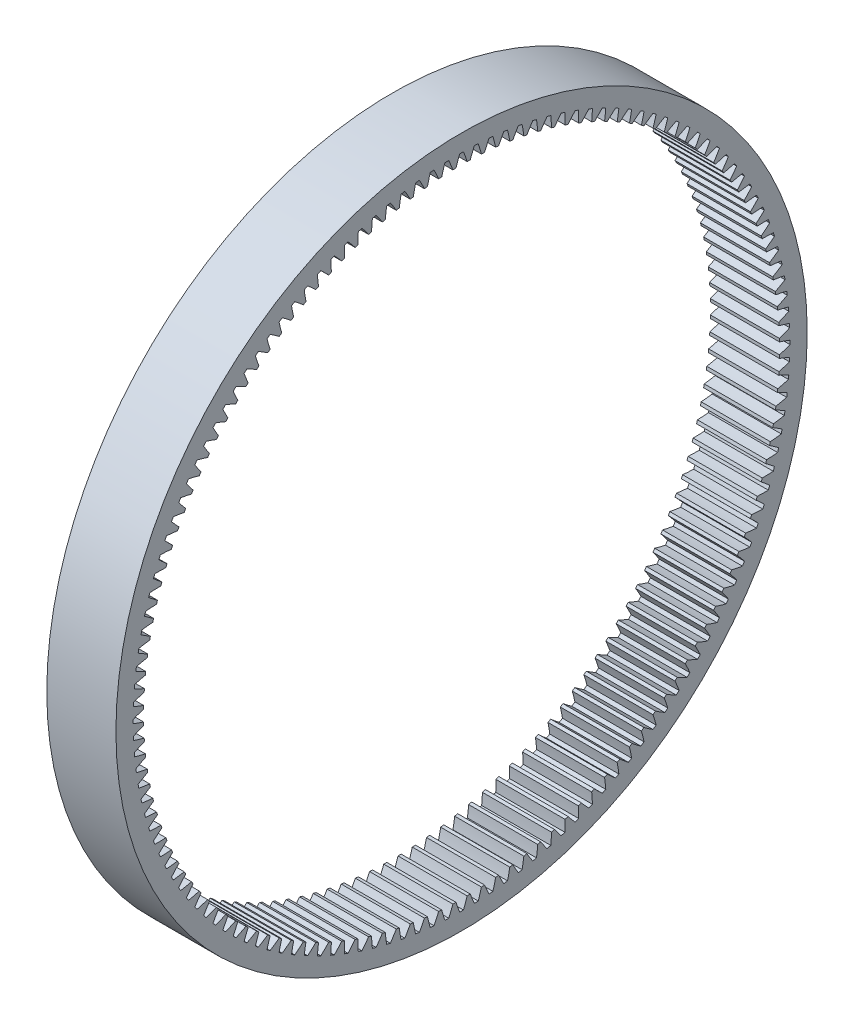
from build123d import *

# Parameters (mm, degrees)
BASPROSKE_W     = 12
BASPROSKE_H     = 4.8
TOOTHCUT_DEPTH  = 86.697141143
TEETHCUTS_COUNT = 140
TEETHCUTS_ANGLE = 357.428571429


with BuildPart() as part:
    # BasProSke → Base-Revolve (revolve)
    with BuildSketch(Plane(origin=(0, 0, 0), x_dir=(1, 0, 0), z_dir=(0, 1, 0)), mode=Mode.PRIVATE) as base_revolve_sk:
        with Locations((6, 57.6)):
            Rectangle(BASPROSKE_W, BASPROSKE_H)
    revolve(base_revolve_sk.sketch.rotate(Axis((-10, 0, 0), (1, 0, 0)), 180), axis=Axis((-10, 0, 0), (1, 0, 0)))

    # TooCutSke → ToothCut (cut, through all)
    with BuildSketch(Plane(origin=(0, 0, 0), x_dir=(0, 0, -1), z_dir=(1, 0, 0))):
        with BuildLine():
            ThreePointArc((0.977522681, 55.165939986), (0.670762671, 56.088589621), (0.33215315, 57.000032239))
            ThreePointArc((0.33215315, 57.000032239), (0, 57.001), (-0.33215315, 57.000032239))
            ThreePointArc((-0.33215315, 57.000032239), (-0.670762671, 56.088589621), (-0.977522681, 55.165939986))
            ThreePointArc((-0.977522681, 55.165939986), (0, 55.1746), (0.977522681, 55.165939986))
        make_face()
    toothcut = extrude(amount=TOOTHCUT_DEPTH, mode=Mode.SUBTRACT)

    # TeethCuts: ToothCut ×140 about axis
    teethcuts_axis = Axis((-10, 0, 0), (1, 0, 0))
    for i in range(1, TEETHCUTS_COUNT):
        add(toothcut.rotate(teethcuts_axis, i * TEETHCUTS_ANGLE / (TEETHCUTS_COUNT - 1)), mode=Mode.SUBTRACT)


solid = part.part
